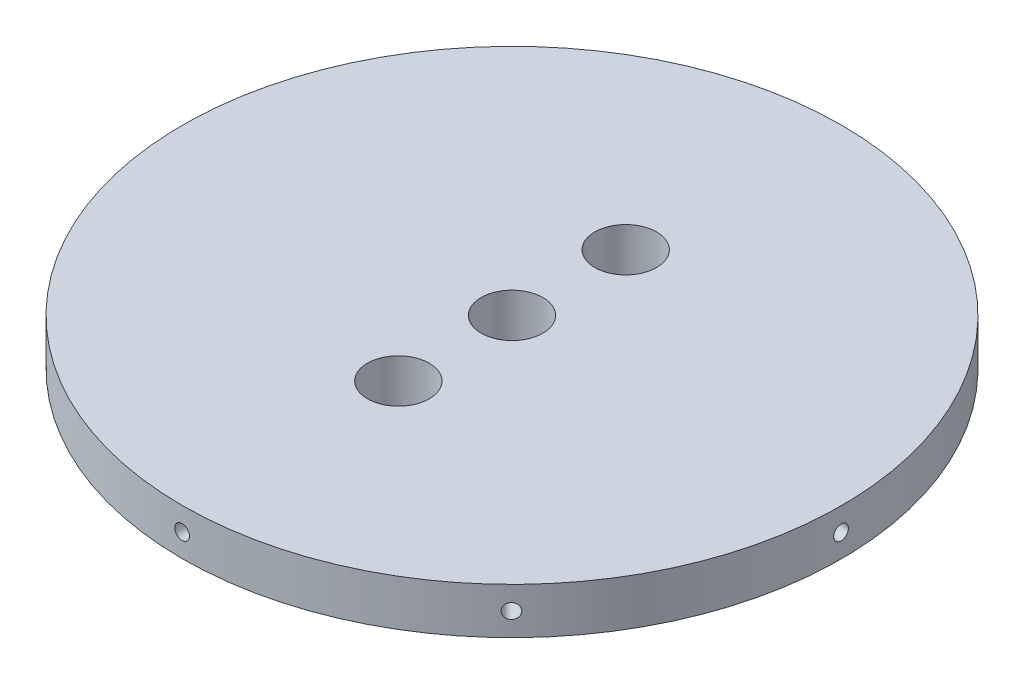
from build123d import *

# Parameters (mm, degrees)
SKETCH1_R                      = 50.8
BOSS_EXTRUDE1_DEPTH            = 7.112
SKETCH2_R                      = 4.7625
CUT_EXTRUDE1_DEPTH             = 73.193216745
F_4_40_TAPPED_HOLE1_AT_2_COUNT = 2
F_4_40_TAPPED_HOLE1_AT_2_PITCH = 18.336817374
CIRPATTERN7_COUNT              = 8


with BuildPart() as part:
    # Sketch1 → Boss-Extrude1 (new body)
    with BuildSketch(Plane(origin=(0, 0, 0), x_dir=(1, 0, 0), z_dir=(0, 1, 0))):
        Circle(SKETCH1_R)
    extrude(amount=BOSS_EXTRUDE1_DEPTH)

    # Sketch2 → Cut-Extrude1 (cut, through all)
    with BuildSketch(Plane.XZ):
        with Locations((0, 17.526)):
            Circle(SKETCH2_R)
        Circle(SKETCH2_R)
        with Locations((0, -17.526)):
            Circle(SKETCH2_R)
    extrude(amount=-CUT_EXTRUDE1_DEPTH, mode=Mode.SUBTRACT)

    # Sketch8 → #4-40 Tapped Hole1 (revolve, cut)
    with BuildSketch(Plane(origin=(-0.062175227, 3.554407485, 50.799961951), x_dir=(0.9999992510074395, 0, 0.0012239217949693564), z_dir=(0, 1, 0))):
        Polygon((0, 0), (0, 10.204152758), (1.1303, 9.525), (1.1303, 0), align=None)
    f_4_40_tapped_hole1 = revolve(axis=Axis((-0.062175227, 3.554407485, 50.799961951), (0.0012239217949693564, 0, -0.9999992510074395)), mode=Mode.SUBTRACT)

    # #4-40 Tapped Hole1 at 2: #4-40 Tapped Hole1 ×2
    with Locations(*[Vector(0.9284303502164903, 0.3715047692262548, 0.0011363269918418131) * (i * F_4_40_TAPPED_HOLE1_AT_2_PITCH) for i in range(1, F_4_40_TAPPED_HOLE1_AT_2_COUNT)]):
        add(f_4_40_tapped_hole1, mode=Mode.SUBTRACT)

    # CirPattern7: #4-40 Tapped Hole1 ×8 about axis
    cirpattern7_axis = Axis((0, 7.112, 0), (0, 1, 0))
    for i in range(1, CIRPATTERN7_COUNT):
        add(f_4_40_tapped_hole1.rotate(cirpattern7_axis, i * 360 / CIRPATTERN7_COUNT), mode=Mode.SUBTRACT)

    # CirPattern7 copy 1 sketch → CirPattern7 copy 1 (revolve, cut)
    with BuildSketch(Plane(origin=(47.92987631, 10.366622592, 23.941586281), x_dir=(0.7079716949696938, 0, -0.7062408081679641), z_dir=(0, 1, 0))):
        Polygon((0, 0), (0, 10.204152758), (1.1303, 9.525), (1.1303, 0), align=None)
    revolve(axis=Axis((47.92987631, 10.366622592, 23.941586281), (-0.7062408081679641, 0, -0.7079716949696938)), mode=Mode.SUBTRACT)

    # CirPattern7 copy 2 sketch → CirPattern7 copy 2 (revolve, cut)
    with BuildSketch(Plane(origin=(50.820798572, 10.366622592, -16.962282549), x_dir=(0.0012239217949694175, 0, -0.9999992510074395), z_dir=(0, 1, 0))):
        Polygon((0, 0), (0, 10.204152758), (1.1303, 9.525), (1.1303, 0), align=None)
    revolve(axis=Axis((50.820798572, 10.366622592, -16.962282549), (-0.9999992510074395, 0, -0.0012239217949694175)), mode=Mode.SUBTRACT)

    # CirPattern7 copy 3 sketch → CirPattern7 copy 3 (revolve, cut)
    with BuildSketch(Plane(origin=(23.941586281, 10.366622592, -47.92987631), x_dir=(-0.7062408081679641, 0, -0.7079716949696938), z_dir=(0, 1, 0))):
        Polygon((0, 0), (0, 10.204152758), (1.1303, 9.525), (1.1303, 0), align=None)
    revolve(axis=Axis((23.941586281, 10.366622592, -47.92987631), (-0.7079716949696938, 0, 0.7062408081679641)), mode=Mode.SUBTRACT)

    # CirPattern7 copy 4 sketch → CirPattern7 copy 4 (revolve, cut)
    with BuildSketch(Plane(origin=(-16.962282549, 10.366622592, -50.820798572), x_dir=(-0.9999992510074395, 0, -0.001223921794969479), z_dir=(0, 1, 0))):
        Polygon((0, 0), (0, 10.204152758), (1.1303, 9.525), (1.1303, 0), align=None)
    revolve(axis=Axis((-16.962282549, 10.366622592, -50.820798572), (-0.001223921794969479, 0, 0.9999992510074395)), mode=Mode.SUBTRACT)

    # CirPattern7 copy 5 sketch → CirPattern7 copy 5 (revolve, cut)
    with BuildSketch(Plane(origin=(-47.92987631, 10.366622592, -23.941586281), x_dir=(-0.7079716949696939, 0, 0.7062408081679641), z_dir=(0, 1, 0))):
        Polygon((0, 0), (0, 10.204152758), (1.1303, 9.525), (1.1303, 0), align=None)
    revolve(axis=Axis((-47.92987631, 10.366622592, -23.941586281), (0.7062408081679641, 0, 0.7079716949696939)), mode=Mode.SUBTRACT)

    # CirPattern7 copy 6 sketch → CirPattern7 copy 6 (revolve, cut)
    with BuildSketch(Plane(origin=(-50.820798572, 10.366622592, 16.962282549), x_dir=(-0.00122392179496954, 0, 0.9999992510074395), z_dir=(0, 1, 0))):
        Polygon((0, 0), (0, 10.204152758), (1.1303, 9.525), (1.1303, 0), align=None)
    revolve(axis=Axis((-50.820798572, 10.366622592, 16.962282549), (0.9999992510074395, 0, 0.00122392179496954)), mode=Mode.SUBTRACT)

    # CirPattern7 copy 7 sketch → CirPattern7 copy 7 (revolve, cut)
    with BuildSketch(Plane(origin=(-23.941586281, 10.366622592, 47.92987631), x_dir=(0.706240808167964, 0, 0.7079716949696939), z_dir=(0, 1, 0))):
        Polygon((0, 0), (0, 10.204152758), (1.1303, 9.525), (1.1303, 0), align=None)
    revolve(axis=Axis((-23.941586281, 10.366622592, 47.92987631), (0.7079716949696939, 0, -0.706240808167964)), mode=Mode.SUBTRACT)


solid = part.part
